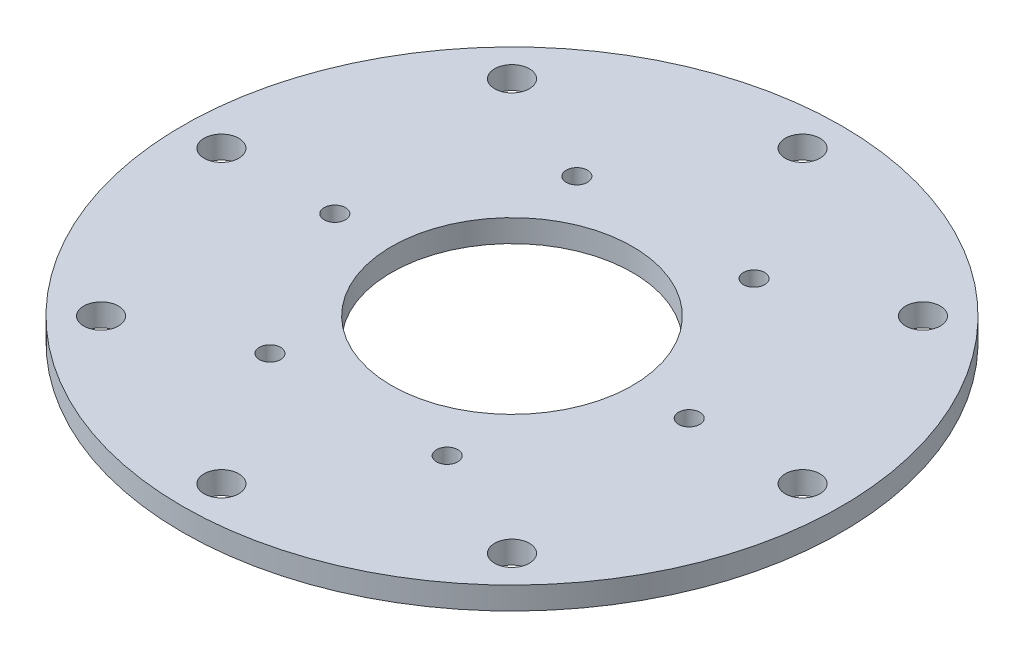
from build123d import *

# Parameters (mm, degrees)
SKETCH2_R           = 46.5
SKETCH2_R_2         = 17
SKETCH2_R_3         = 2.45
SKETCH2_R_4         = 1.5
BOSS_EXTRUDE1_DEPTH = 3.175


with BuildPart() as part:
    # Sketch2 → Boss-Extrude1 (new body)
    with BuildSketch(Plane(origin=(0, 0, 0), x_dir=(1, 0, 0), z_dir=(0, 1, 0))):
        Circle(SKETCH2_R)
        Circle(SKETCH2_R_2, mode=Mode.SUBTRACT)
        with Locations((-41, 0)):
            Circle(SKETCH2_R_3, mode=Mode.SUBTRACT)
        with Locations((-25, 0)):
            Circle(SKETCH2_R_4, mode=Mode.SUBTRACT)
        with Locations((-12.5, 21.650635095)):
            Circle(SKETCH2_R_4, mode=Mode.SUBTRACT)
        with Locations((12.5, 21.650635095)):
            Circle(SKETCH2_R_4, mode=Mode.SUBTRACT)
        with Locations((25, 0)):
            Circle(SKETCH2_R_4, mode=Mode.SUBTRACT)
        with Locations((12.5, -21.650635095)):
            Circle(SKETCH2_R_4, mode=Mode.SUBTRACT)
        with Locations((-12.5, -21.650635095)):
            Circle(SKETCH2_R_4, mode=Mode.SUBTRACT)
        with Locations((-28.991378029, 28.991378029)):
            Circle(SKETCH2_R_3, mode=Mode.SUBTRACT)
        with Locations((0, 41)):
            Circle(SKETCH2_R_3, mode=Mode.SUBTRACT)
        with Locations((28.991378029, 28.991378029)):
            Circle(SKETCH2_R_3, mode=Mode.SUBTRACT)
        with Locations((41, 0)):
            Circle(SKETCH2_R_3, mode=Mode.SUBTRACT)
        with Locations((28.991378029, -28.991378029)):
            Circle(SKETCH2_R_3, mode=Mode.SUBTRACT)
        with Locations((0, -41)):
            Circle(SKETCH2_R_3, mode=Mode.SUBTRACT)
        with Locations((-28.991378029, -28.991378029)):
            Circle(SKETCH2_R_3, mode=Mode.SUBTRACT)
    extrude(amount=BOSS_EXTRUDE1_DEPTH)


solid = part.part
